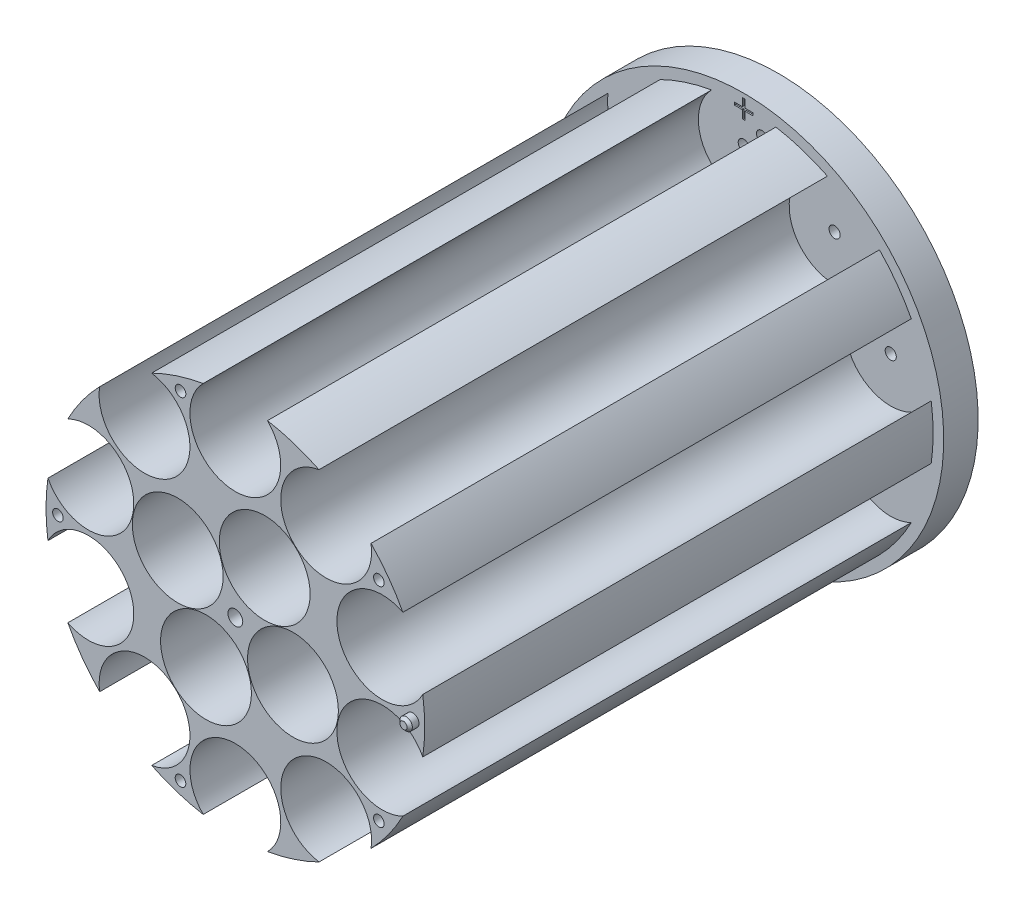
from build123d import *
from build123d.topology import SkipClean

# Parameters (mm, degrees)
ESQUISSE1_R             = 75.75
ESQUISSE1_R_2           = 17.15
BOSS_EXTRU_2_DEPTH      = 192
ESQUISSE2_R             = 76
ESQUISSE2_R_2           = 71.5
ENL_V_MAT_EXTRU_1_DEPTH = 310
ESQUISSE3_R             = 75.5
ESQUISSE3_R_2           = 2
BOSS_EXTRU_3_DEPTH      = 5
ESQUISSE4_R             = 2.1
ENL_V_MAT_EXTRU_2_DEPTH = 5
ESQUISSE5_R             = 75.5
ESQUISSE5_R_2           = 65.5
BOSS_EXTRU_4_DEPTH      = 8
ENL_V_START             = -10
ESQUISSE6_R             = 2
ENL_V_MAT_EXTRU_4_DEPTH = 10
ESQUISSE8_R             = 2
ESQUISSE8_R_2           = 2.8
ENL_V_MAT_EXTRU_5_DEPTH = 5.7
ESQUISSE10_R            = 1.5
ESQUISSE10_R_2          = 2
ENL_V_MAT_EXTRU_6_DEPTH = 15
ESQUISSE11_R            = 71.5
ENL_V_MAT_EXTRU_7_DEPTH = 8
ESQUISSE12_W            = 7
ESQUISSE12_H            = 1
ENL_V_MAT_EXTRU_8_DEPTH = 0.5
ESQUISSE13_R            = 2.35
BOSS_EXTRU_6_DEPTH      = 3.5
CHANFREIN1_SIZE         = 1


with BuildPart() as part:
    # Esquisse1 → Boss.-Extru.2 (new body)
    with BuildSketch(Plane.XY):
        Circle(ESQUISSE1_R)
        with Locations((-34.305739626, 47.199986533)):
            Circle(ESQUISSE1_R_2, mode=Mode.SUBTRACT)
        with Locations((-0.010470369, 58.349999061)):
            Circle(ESQUISSE1_R_2, mode=Mode.SUBTRACT)
        with Locations((34.288798212, 47.212295191)):
            Circle(ESQUISSE1_R_2, mode=Mode.SUBTRACT)
        with Locations((55.49091131, 18.041099245)):
            Circle(ESQUISSE1_R_2, mode=Mode.SUBTRACT)
        with Locations((55.497382355, -18.021183418)):
            Circle(ESQUISSE1_R_2, mode=Mode.SUBTRACT)
        with Locations((34.305739626, -47.199986533)):
            Circle(ESQUISSE1_R_2, mode=Mode.SUBTRACT)
        with Locations((0.010470369, -58.349999061)):
            Circle(ESQUISSE1_R_2, mode=Mode.SUBTRACT)
        with Locations((-34.288798212, -47.212295191)):
            Circle(ESQUISSE1_R_2, mode=Mode.SUBTRACT)
        with Locations((-55.49091131, -18.041099245)):
            Circle(ESQUISSE1_R_2, mode=Mode.SUBTRACT)
        with Locations((-55.497382355, 18.021183418)):
            Circle(ESQUISSE1_R_2, mode=Mode.SUBTRACT)
        with Locations((-21.759702771, 11.082204515)):
            Circle(ESQUISSE1_R_2, mode=Mode.SUBTRACT)
        with Locations((11.082204515, 21.759702771)):
            Circle(ESQUISSE1_R_2, mode=Mode.SUBTRACT)
        with Locations((21.759702771, -11.082204515)):
            Circle(ESQUISSE1_R_2, mode=Mode.SUBTRACT)
        with Locations((-11.082204515, -21.759702771)):
            Circle(ESQUISSE1_R_2, mode=Mode.SUBTRACT)
    extrude(amount=BOSS_EXTRU_2_DEPTH)

    # Esquisse2 → Enlèv. mat.-Extru.1 (cut)
    with BuildSketch(Plane(origin=(0, 0, 0), x_dir=(-1, 0, 0), z_dir=(0, 0, -1))):
        Circle(ESQUISSE2_R)
        Circle(ESQUISSE2_R_2, mode=Mode.SUBTRACT)
    extrude(amount=-ENL_V_MAT_EXTRU_1_DEPTH, mode=Mode.SUBTRACT)

    # Esquisse3 → Boss.-Extru.3 (add)
    with BuildSketch(Plane(origin=(0, 0, 0), x_dir=(-1, 0, 0), z_dir=(0, 0, -1))):
        Circle(ESQUISSE3_R)
        with Locations((6.776911329, -64.589491695)):
            Circle(ESQUISSE3_R_2, mode=Mode.SUBTRACT)
        with Locations((-6.788589165, 64.700790989)):
            Circle(ESQUISSE3_R_2, mode=Mode.SUBTRACT)
    extrude(amount=BOSS_EXTRU_3_DEPTH)

    # Esquisse4 → Enlèv. mat.-Extru.2 (cut)
    with BuildSketch(Plane(origin=(0, 0, -5), x_dir=(-1, 0, 0), z_dir=(0, 0, -1))):
        with Locations((55.49091131, -18.041099245)):
            Circle(ESQUISSE4_R)
        with Locations((34.288798212, -47.212295191)):
            Circle(ESQUISSE4_R)
        with Locations((-0.010470369, -58.349999061)):
            Circle(ESQUISSE4_R)
        with Locations((-34.305739626, -47.199986533)):
            Circle(ESQUISSE4_R)
        with Locations((-55.497382355, -18.021183418)):
            Circle(ESQUISSE4_R)
        with Locations((-55.49091131, 18.041099245)):
            Circle(ESQUISSE4_R)
        with Locations((-34.288798212, 47.212295191)):
            Circle(ESQUISSE4_R)
        with Locations((0.010470369, 58.349999061)):
            Circle(ESQUISSE4_R)
        with Locations((34.305739626, 47.199986533)):
            Circle(ESQUISSE4_R)
        with Locations((55.497382355, 18.021183418)):
            Circle(ESQUISSE4_R)
        with Locations((11.082204515, -21.759702771)):
            Circle(ESQUISSE4_R)
        with Locations((-21.759702771, -11.082204515)):
            Circle(ESQUISSE4_R)
        with Locations((-11.082204515, 21.759702771)):
            Circle(ESQUISSE4_R)
        with Locations((21.759702771, 11.082204515)):
            Circle(ESQUISSE4_R)
    extrude(amount=-ENL_V_MAT_EXTRU_2_DEPTH, mode=Mode.SUBTRACT)

    # Esquisse5 → Boss.-Extru.4 (add)
    with BuildSketch(Plane(origin=(0, 0, -5), x_dir=(-1, 0, 0), z_dir=(0, 0, -1))):
        Circle(ESQUISSE5_R)
        with Locations(Location((0, 0, 0), (0, 0, 97.701419097))):
            Circle(ESQUISSE5_R_2, mode=Mode.SUBTRACT)
    extrude(amount=BOSS_EXTRU_4_DEPTH)

    # Esquisse6 → Enlèv. mat.-Extru.4 (cut)
    with SkipClean():  # the faces are left unmerged after this step: merging them gives an invalid solid
        with BuildSketch(Plane(origin=(0, 0, -13), x_dir=(-1, 0, 0), z_dir=(0, 0, -1)).offset(ENL_V_START)):
            with Locations(Location((-6.788589165, 64.700790989, 0), (0, 0, 174.019176169))):
                Circle(ESQUISSE6_R)
            with Locations(Location((6.776911329, -64.589491695, 0), (0, 0, 201.283568474))):
                Circle(ESQUISSE6_R)
        extrude(amount=ENL_V_MAT_EXTRU_4_DEPTH, mode=Mode.SUBTRACT)
    add(part.part.scale(1), mode=Mode.REPLACE)  # the faces are merged on a copy

    # Esquisse8 → Enlèv. mat.-Extru.5 (cut)
    with BuildSketch(Plane.XY.offset(192)):
        with Locations((-20.704138623, -63.720786592)):
            Circle(ESQUISSE8_R)
        with Locations((-67, 0)):
            Circle(ESQUISSE8_R)
        with Locations((-20.704138623, 63.720786592)):
            Circle(ESQUISSE8_R)
        with Locations((54.204138623, 39.381611904)):
            Circle(ESQUISSE8_R)
        with Locations((54.204138623, -39.381611904)):
            Circle(ESQUISSE8_R)
        Circle(ESQUISSE8_R_2)
    extrude(amount=-ENL_V_MAT_EXTRU_5_DEPTH, mode=Mode.SUBTRACT)

    # Esquisse10 → Enlèv. mat.-Extru.6 (cut)
    with BuildSketch(Plane.XY.offset(186.3)):
        with Locations((-20.704138623, -63.720786592)):
            Circle(ESQUISSE10_R)
        with Locations((-67, 0)):
            Circle(ESQUISSE10_R)
        with Locations((-20.704138623, 63.720786592)):
            Circle(ESQUISSE10_R)
        with Locations((54.204138623, 39.381611904)):
            Circle(ESQUISSE10_R)
        with Locations((54.204138623, -39.381611904)):
            Circle(ESQUISSE10_R)
        Circle(ESQUISSE10_R_2)
    extrude(amount=-ENL_V_MAT_EXTRU_6_DEPTH, mode=Mode.SUBTRACT)

    # Esquisse11 → Enlèv. mat.-Extru.7 (cut)
    with BuildSketch(Plane(origin=(0, 0, -13), x_dir=(-1, 0, 0), z_dir=(0, 0, -1))):
        Circle(ESQUISSE11_R)
    extrude(amount=-ENL_V_MAT_EXTRU_7_DEPTH, mode=Mode.SUBTRACT)

    # Esquisse12 → Enlèv. mat.-Extru.8 (cut)
    with BuildSketch(Plane.XY):
        with Locations((0.010470369, -69.659338912)):
            Rectangle(ESQUISSE12_W, ESQUISSE12_H)
        Polygon((-0.510470369, 70.811208438), (-0.510470369, 73.811208438), (0.489529631, 73.811208438), (0.489529631, 70.811208438), (3.489529631, 70.811208438), (3.489529631, 69.811208438), (0.489529631, 69.811208438), (0.489529631, 66.811208438), (-0.510470369, 66.811208438), (-0.510470369, 69.811208438), (-3.510470369, 69.811208438), (-3.510470369, 70.811208438), align=None)
    extrude(amount=-ENL_V_MAT_EXTRU_8_DEPTH, mode=Mode.SUBTRACT)

    # Esquisse13 → Boss.-Extru.6 (add)
    with BuildSketch(Plane.XY.offset(192)):
        with Locations((67, 0)):
            Circle(ESQUISSE13_R)
    extrude(amount=BOSS_EXTRU_6_DEPTH)

    # Chanfrein1
    chanfrein1_edges = [part.edges().sort_by_distance(p)[0] for p in [
        (64.65, 0, 195.5),
    ]]
    chamfer(chanfrein1_edges, length=CHANFREIN1_SIZE)


solid = part.part
